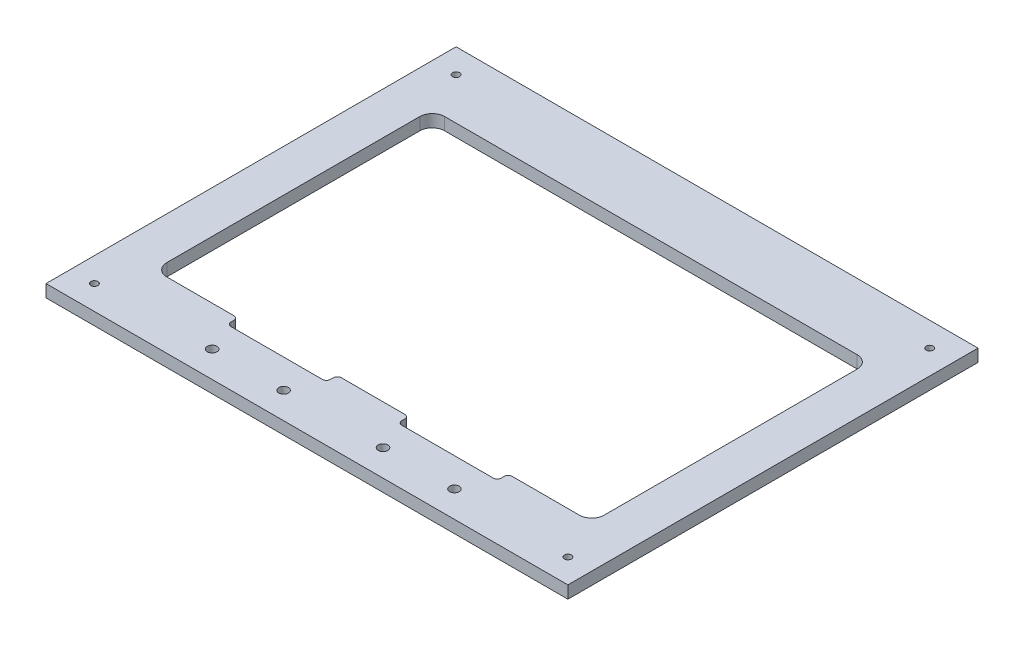
from build123d import *

# Parameters (mm, degrees)
SKETCH1_W             = 266.7
SKETCH1_H             = 209.55
BOSS_EXTRUDE1_DEPTH   = 6.35
M3_CLEARANCE_HOLE1_D  = 3.6
SKETCH4_W             = 223.52
SKETCH4_H             = 141.986
CUT_EXTRUDE1_DEPTH    = 170.706645789
F_8_CLEARANCE_HOLE1_D = 4.9149
SKETCH7_W             = 50.8
SKETCH7_H             = 5.588
CUT_EXTRUDE2_DEPTH    = 170.706645789
FILLET1_R             = 6.35
FILLET2_R             = 2.032


with BuildPart() as part:
    # Sketch1 → Boss-Extrude1 (new body)
    with BuildSketch(Plane(origin=(0, 0, 0), x_dir=(1, 0, 0), z_dir=(0, 1, 0))):
        Rectangle(SKETCH1_W, SKETCH1_H)
    extrude(amount=BOSS_EXTRUDE1_DEPTH)

    # M3 Clearance Hole1 (through all)
    with Locations(Plane(origin=(0, 6.35, 0), x_dir=(1, 0, 0), z_dir=(0, 1, 0))):
        with Locations((121.0056, -92.4306), (-121.0056, -92.4306), (-121.0056, 92.4306), (121.0056, 92.4306)):
            Hole(M3_CLEARANCE_HOLE1_D / 2)

    # Sketch4 → Cut-Extrude1 (cut, through all)
    with BuildSketch(Plane(origin=(0, 6.35, 0), x_dir=(1, 0, 0), z_dir=(0, 1, 0))):
        Rectangle(SKETCH4_W, SKETCH4_H)
    extrude(amount=-CUT_EXTRUDE1_DEPTH, mode=Mode.SUBTRACT)

    # #8 Clearance Hole1 (through all)
    with Locations(Plane(origin=(0, 6.35, 0), x_dir=(1, 0, 0), z_dir=(0, 1, 0))):
        with Locations((-61.9125, -91.313), (-25.4, -91.313), (25.4, -91.313), (61.9125, -91.313)):
            Hole(F_8_CLEARANCE_HOLE1_D / 2)

    # Sketch7 → Cut-Extrude2 (cut, through all)
    with BuildSketch(Plane(origin=(0, 6.35, 0), x_dir=(1, 0, 0), z_dir=(0, 1, 0))):
        with Locations((-43.65625, -73.787)):
            Rectangle(SKETCH7_W, SKETCH7_H)
        with Locations((43.65625, -73.787)):
            Rectangle(SKETCH7_W, SKETCH7_H)
    extrude(amount=-CUT_EXTRUDE2_DEPTH, mode=Mode.SUBTRACT)

    # Fillet1
    fillet1_edges = [part.edges().sort_by_distance(p)[0] for p in [
        (111.76, 3.175, -70.993),
        (111.76, 3.175, 70.993),
        (-111.76, 3.175, 70.993),
        (-111.76, 3.175, -70.993),
    ]]
    fillet(fillet1_edges, radius=FILLET1_R)

    # Fillet2
    fillet2_edges = [part.edges().sort_by_distance(p)[0] for p in [
        (69.05625, 3.175, 70.993),
        (69.05625, 3.175, 76.581),
        (18.25625, 3.175, 76.581),
        (18.25625, 3.175, 70.993),
        (-18.25625, 3.175, 70.993),
        (-18.25625, 3.175, 76.581),
        (-69.05625, 3.175, 70.993),
        (-69.05625, 3.175, 76.581),
    ]]
    fillet(fillet2_edges, radius=FILLET2_R)


solid = part.part
